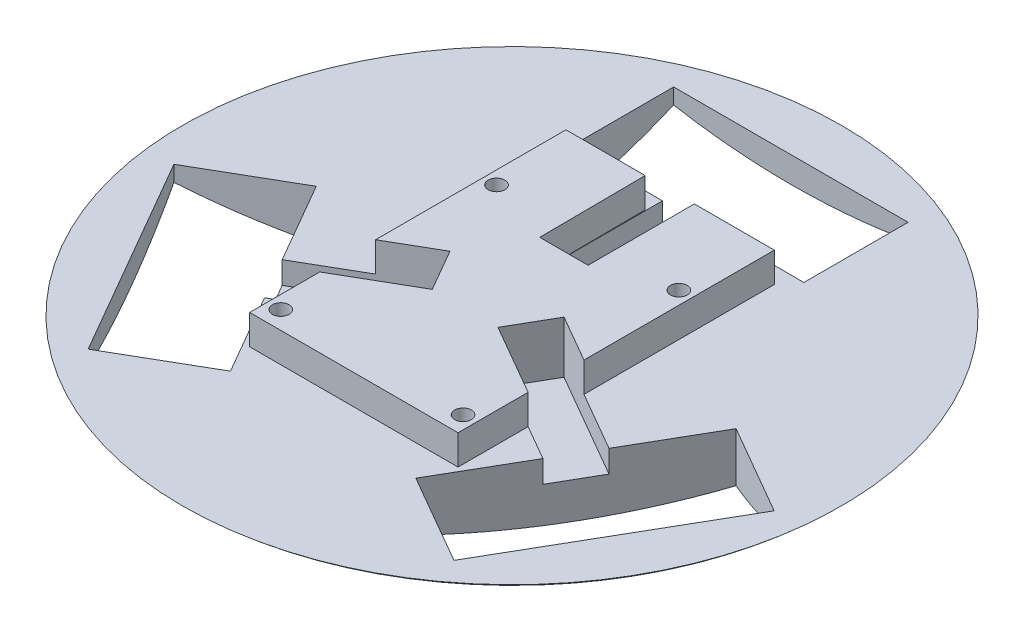
from build123d import *

# Parameters (mm, degrees)
SKETCH2_W           = 63
SKETCH2_H           = 28
CUT_EXTRUDE1_DEPTH  = 40
SKETCH4_W           = 13
SKETCH4_H           = 33
CUT_EXTRUDE2_DEPTH  = 6
SKETCH5_R           = 2.25
BOSS_EXTRUDE1_DEPTH = 8


with BuildPart() as part:
    # Sketch3 → Revolve1 (revolve)
    with BuildSketch(Plane(origin=(0, 0, 0), x_dir=(0, 0, -1), z_dir=(1, 0, 0))):
        with BuildLine():
            Line((0, 20), (0, 0))
            ThreePointArc((0, 0), (43.440585665, 3.508757487), (84.753971762, 17.38679738))
            ThreePointArc((84.753971762, 17.38679738), (86.762776598, 18.545504508), (88.56897203, 20))
            Line((88.56897203, 20), (0, 20))
        make_face()
    revolve(axis=Axis((0, 20, 0), (0, -1, 0)))

    # Sketch2 → Cut-Extrude1 (cut)
    with BuildSketch(Plane(origin=(0, 0, 0), x_dir=(1, 0, 0), z_dir=(0, 1, 0))):
        with Locations((0, 60.949465814)):
            Rectangle(SKETCH2_W, SKETCH2_H)
        Polygon((80.658141395, -10.194932688), (49.158141395, -64.754533126), (24.909430089, -50.754533126), (56.409430089, 3.805067312), align=None)
        Polygon((-49.158141395, -64.754533126), (-80.658141395, -10.194932688), (-56.409430089, 3.805067312), (-24.909430089, -50.754533126), align=None)
    extrude(amount=CUT_EXTRUDE1_DEPTH, mode=Mode.SUBTRACT)

    # Sketch4 → Cut-Extrude2 (cut)
    with BuildSketch(Plane(origin=(0, 20, 0), x_dir=(1, 0, 0), z_dir=(0, 1, 0))):
        with Locations((0, 30.449465814)):
            Rectangle(SKETCH4_W, SKETCH4_H)
        Polygon((37.409430089, -29.103898031), (43.909430089, -17.845567782), (15.330591764, -1.345567782), (8.830591764, -12.603898031), align=None)
        Polygon((-43.909430089, -17.845567782), (-37.409430089, -29.103898031), (-8.830591764, -12.603898031), (-15.330591764, -1.345567782), align=None)
    extrude(amount=-CUT_EXTRUDE2_DEPTH, mode=Mode.SUBTRACT)

    # Sketch5 → Boss-Extrude1 (add)
    with BuildSketch(Plane(origin=(0, 20, 0), x_dir=(1, 0, 0), z_dir=(0, 1, 0))):
        Polygon((-28, -23.671361037), (-8.830591764, -12.603898031), (-15.330591764, -1.345567782), (-28, -8.660254038), (-28, 42.5), (-6.711328351, 42.5), (-6.5, 13.949465814), (6.5, 13.949465814), (6.5, 42.5), (28, 42.5), (28, -8.660254038), (15.330591764, -1.345567782), (8.830591764, -12.603898031), (28, -23.671361037), (28, -42.5), (-28, -42.5), align=None)
        with Locations((-24.5, -37.660254038)):
            Circle(SKETCH5_R, mode=Mode.SUBTRACT)
        with Locations((24.5, -37.660254038)):
            Circle(SKETCH5_R, mode=Mode.SUBTRACT)
        with Locations((24.5, 20.339745962)):
            Circle(SKETCH5_R, mode=Mode.SUBTRACT)
        with Locations((-24.5, 20.339745962)):
            Circle(SKETCH5_R, mode=Mode.SUBTRACT)
    extrude(amount=BOSS_EXTRUDE1_DEPTH)


solid = part.part
